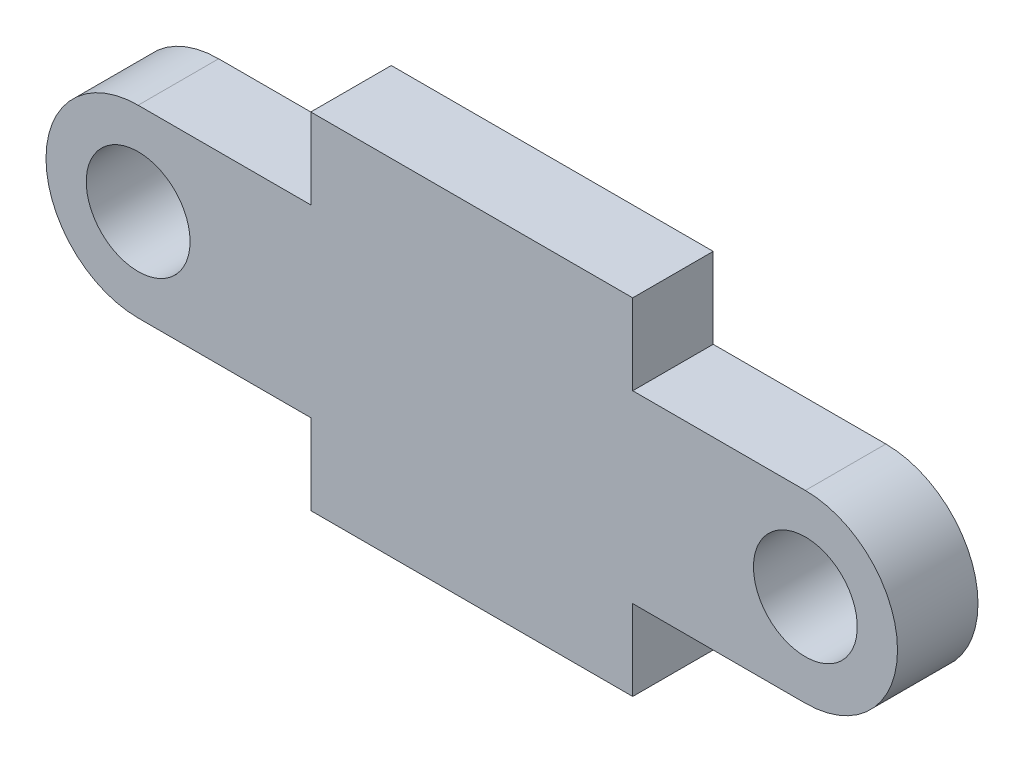
from build123d import *

# Parameters (mm, degrees)
SKETCH1_R           = 6.45
BOSS_EXTRUDE1_DEPTH = 10


with BuildPart() as part:
    # Sketch1 → Boss-Extrude1 (new body)
    with BuildSketch(Plane.XY):
        with BuildLine():
            Line((-41.567521433, 11.45), (-20.117521433, 11.45))
            Line((-20.117521433, 11.45), (-20.117521433, 21.45))
            Line((-20.117521433, 21.45), (19.882478567, 21.45))
            Line((19.882478567, 21.45), (19.882478567, 11.45))
            Line((19.882478567, 11.45), (41.332478567, 11.45))
            ThreePointArc((41.332478567, 11.45), (52.782478567, 0), (41.332478567, -11.45))
            Line((41.332478567, -11.45), (19.882478567, -11.45))
            Line((19.882478567, -11.45), (19.882478567, -21.45))
            Line((19.882478567, -21.45), (-20.117521433, -21.45))
            Line((-20.117521433, -21.45), (-20.117521433, -11.45))
            Line((-20.117521433, -11.45), (-41.567521433, -11.45))
            ThreePointArc((-41.567521433, -11.45), (-53.017521433, 0), (-41.567521433, 11.45))
        make_face()
        with Locations((-41.567521433, 0)):
            Circle(SKETCH1_R, mode=Mode.SUBTRACT)
        with Locations((41.332478567, 0)):
            Circle(SKETCH1_R, mode=Mode.SUBTRACT)
    extrude(amount=-BOSS_EXTRUDE1_DEPTH)


solid = part.part
